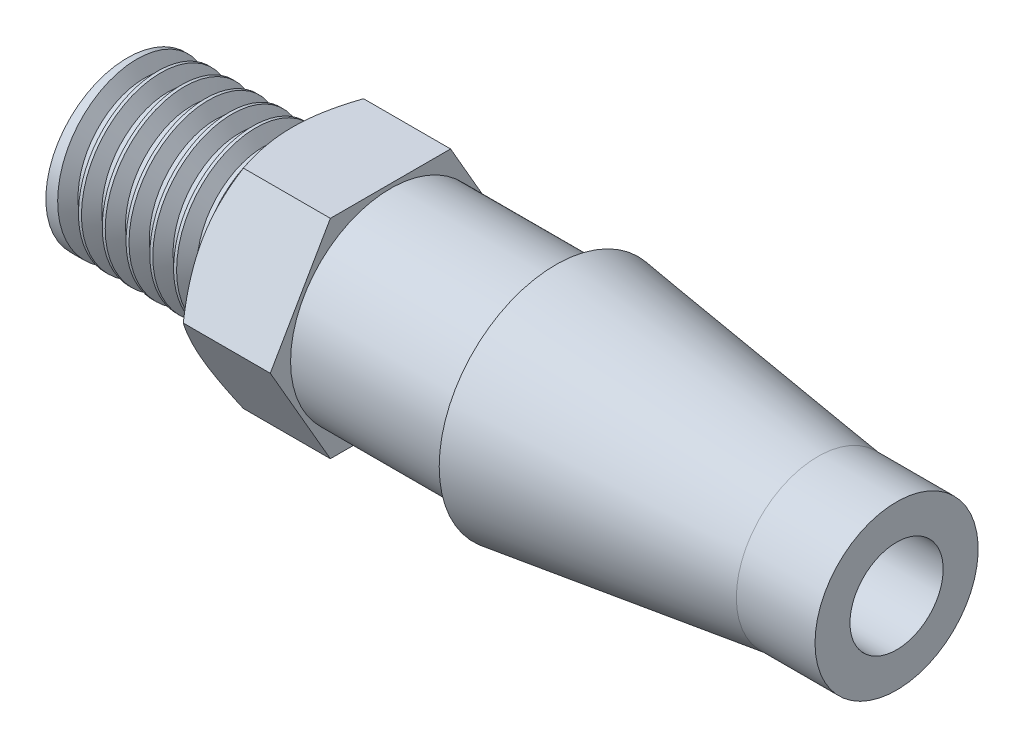
from build123d import *

# Parameters (mm, degrees)
CUT_EXTRUDE_THIN1_DEPTH = 10
THREAD1_PITCH           = 0.907142857


with BuildPart() as part:
    # Sketch1 → Revolve1 (revolve)
    with BuildSketch(Plane.XY, mode=Mode.PRIVATE) as revolve1_sk:
        Polygon((0, 1.778), (29.337, 1.778), (29.337, 3.1115), (26.337, 3.1115), (16.337, 4.445), (16.337, 3.81), (10.033, 3.81), (10.033, 4.5847), (6.715, 4.5847), (5.715, 3.1115), (0, 3.1115), align=None)
    revolve(revolve1_sk.sketch.rotate(Axis((-14.698133333, 0, 0), (1, 0, 0)), 90), axis=Axis((-14.698133333, 0, 0), (1, 0, 0)))

    # Sketch2 → Cut-Extrude-Thin1 (cut)
    with BuildSketch(Plane(origin=(10.033, 0, 0), x_dir=(0, 0, -1), z_dir=(1, 0, 0))):
        Polygon((-8.065852692, 13.970466669), (8.065852692, 13.970466669), (16.131705384, 0), (8.065852692, -13.970466669), (-8.065852692, -13.970466669), (-16.131705384, 0), align=None)
        Polygon((-2.29235, 3.970466669), (2.29235, 3.970466669), (4.5847, 0), (2.29235, -3.970466669), (-2.29235, -3.970466669), (-4.5847, 0), align=None, mode=Mode.SUBTRACT)
    extrude(amount=-CUT_EXTRUDE_THIN1_DEPTH, mode=Mode.SUBTRACT)

    # Thread1: the profile of Thread Profile1 profile screwed along a right-hand helix of 6.3 turns, 8 arcs to a turn; built about Z, then put on its axis
    thread1_z = Axis((0, 0, 0), (0, 0, 1))
    thread1_corners = [(3.1118, 0, -0.000173205), (3.1118, 0, 0.793923203), (2.620494528, 0, 0.510267856), (2.620494528, 0, 0.283482142)]
    with BuildLine(mode=Mode.PRIVATE) as thread1_profile:
        Line(thread1_corners[0], thread1_corners[1])
        Line(thread1_corners[1], thread1_corners[2])
        Line(thread1_corners[2], thread1_corners[3])
        Line(thread1_corners[3], thread1_corners[0])
    thread1_cap = Face(thread1_profile.wire())
    thread1_turn_angles = [0, 22.5, 45, 67.5, 90, 112.5, 135, 157.5, 180, 202.5, 225, 247.5, 270, 292.5, 315, 337.5, 360]
    thread1_turn_weights = [1, 0.9238795325112867, 1, 0.9238795325112867, 1, 0.9238795325112867, 1, 0.9238795325112867, 1, 0.9238795325112867, 1, 0.9238795325112867, 1, 0.9238795325112867, 1, 0.9238795325112867, 1]
    thread1_turn_rails = [Edge.make_bspline([Vector(p[0], p[1], 0).rotate(thread1_z, thread1_turn_angles[k]) / thread1_turn_weights[k] + Vector(0, 0, p[2] + THREAD1_PITCH * thread1_turn_angles[k] / 360) for k in range(17)], [0, 0, 0, 1, 1, 2, 2, 3, 3, 4, 4, 5, 5, 6, 6, 7, 7, 8, 8, 8], 2, thread1_turn_weights) for p in thread1_corners]
    thread1_turn_sides = [Face.make_surface_from_curves(thread1_turn_rails[p[0]], thread1_turn_rails[p[1]]) for p in [(0, 1), (1, 2), (2, 3), (3, 0)]]
    thread1_last_angles = [2160, 2182.5, 2205, 2227.5, 2250, 2259, 2268]
    thread1_last_weights = [1, 0.9238795325112867, 1, 0.9238795325112867, 1, 0.9876883405951364, 1]
    thread1_last_rails = [Edge.make_bspline([Vector(p[0], p[1], 0).rotate(thread1_z, thread1_last_angles[k]) / thread1_last_weights[k] + Vector(0, 0, p[2] + THREAD1_PITCH * thread1_last_angles[k] / 360) for k in range(7)], [0, 0, 0, 1, 1, 2, 2, 3, 3, 3], 2, thread1_last_weights) for p in thread1_corners]
    thread1_last_sides = [Face.make_surface_from_curves(thread1_last_rails[p[0]], thread1_last_rails[p[1]]) for p in [(0, 1), (1, 2), (2, 3), (3, 0)]]
    thread1 = Plane(origin=(0, 0, 0), x_dir=(0, 0, -1), z_dir=(1, 0, 0)) * Solid(Shell([*[p.moved(Location((0, 0, THREAD1_PITCH * i))) for i in range(6) for p in thread1_turn_sides], *thread1_last_sides, thread1_cap, thread1_cap.rotate(thread1_z, 2268).moved(Location((0, 0, THREAD1_PITCH * 2268 / 360)))]))
    add(thread1, mode=Mode.SUBTRACT)


solid = part.part
